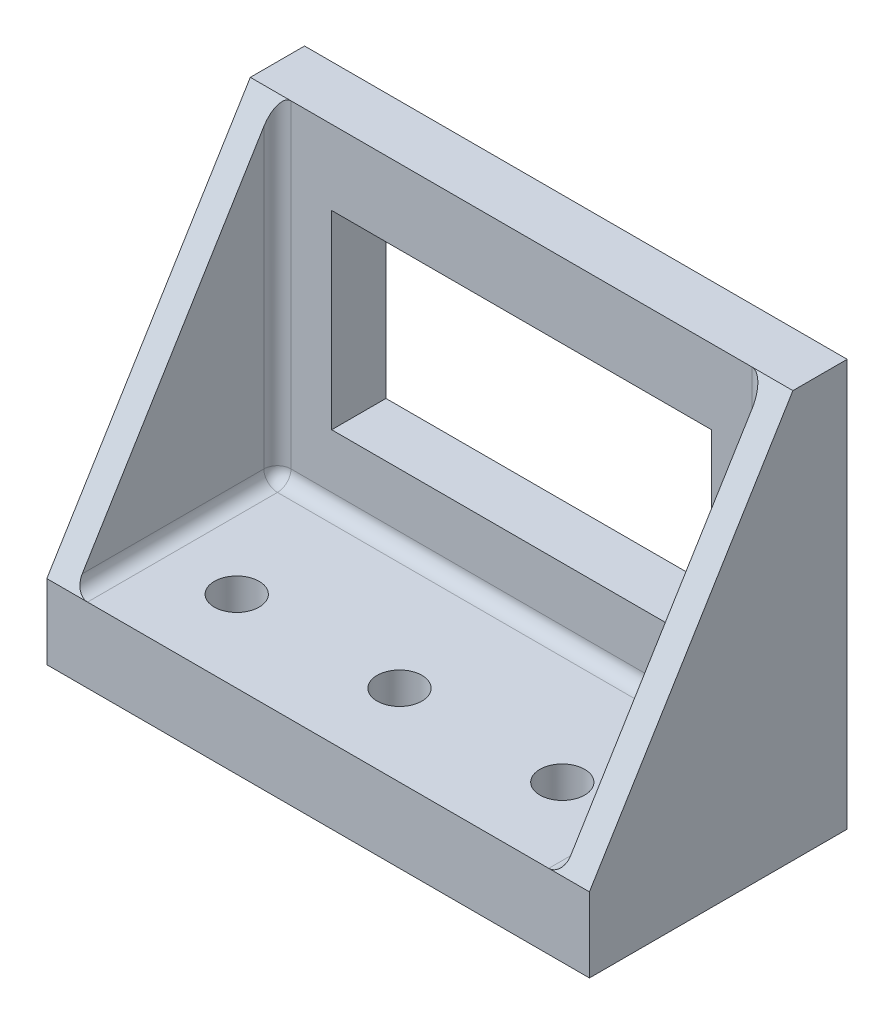
from build123d import *

# Parameters (mm, degrees)
SKETCH1_W           = 40
SKETCH1_H           = 30
BOSS_EXTRUDE1_DEPTH = 4
SKETCH4_W           = 28
SKETCH4_H           = 14
CUT_EXTRUDE1_DEPTH  = 5.5
SKETCH5_W           = 40
SKETCH5_H           = 5.5
BOSS_EXTRUDE2_DEPTH = 15
SKETCH6_R           = 1.65
CUT_EXTRUDE3_DEPTH  = 15
RIB1_REACH          = 50.297
SKETCH8_WALL_W      = 127.321837908
SKETCH8_WALL_H      = 2
RIB14_REACH         = 50.297
SKETCH11_WALL_W     = 127.321837908
SKETCH11_WALL_H     = 2
FILLET1_R           = 1


with BuildPart() as part:
    # Sketch1 → Boss-Extrude1 (new body)
    with BuildSketch(Plane.XY):
        with Locations((-0.222222222, -4.277777778)):
            Rectangle(SKETCH1_W, SKETCH1_H)
    extrude(amount=BOSS_EXTRUDE1_DEPTH)

    # Sketch4 → Cut-Extrude1 (cut)
    with BuildSketch(Plane.XY.offset(4)):
        with Locations((-0.222222222, -1.777777778)):
            Rectangle(SKETCH4_W, SKETCH4_H)
    extrude(amount=-CUT_EXTRUDE1_DEPTH, mode=Mode.SUBTRACT)

    # Sketch5 → Boss-Extrude2 (add)
    with BuildSketch(Plane.XY.offset(4)):
        with Locations((-0.222222222, -16.527777778)):
            Rectangle(SKETCH5_W, SKETCH5_H)
    extrude(amount=BOSS_EXTRUDE2_DEPTH)

    # Sketch6 → Cut-Extrude3 (cut)
    with BuildSketch(Plane.XZ.offset(19.277777778)):
        with Locations((-12.222222222, 13)):
            Circle(SKETCH6_R)
        with Locations((-0.222222222, 13)):
            Circle(SKETCH6_R)
        with Locations((11.777777778, 13)):
            Circle(SKETCH6_R)
    extrude(amount=-CUT_EXTRUDE3_DEPTH, mode=Mode.SUBTRACT)

    # Sketch8 wall → Rib1 (add, up to next)
    with BuildSketch(Plane(origin=(-20.222222222, -1.527777778, 11.5), x_dir=(0, -0.852851304076, 0.522153859639), z_dir=(0, 0.522153859639, 0.852851304076)), mode=Mode.PRIVATE) as rib1_sk1:
        with Locations((0, 1)):
            Rectangle(SKETCH8_WALL_W, SKETCH8_WALL_H)
    rib1_tool1 = extrude(rib1_sk1.sketch, amount=-RIB1_REACH, mode=Mode.PRIVATE) - part.part
    add(rib1_tool1.solids().sort_by_distance((-20.222222222, -1.527777778, 11.5))[0])

    # Sketch11 wall → Rib14 (add, up to next)
    with BuildSketch(Plane(origin=(19.777777778, -1.527777778, 11.5), x_dir=(0, 0.852851304076, -0.522153859639), z_dir=(0, 0.522153859639, 0.852851304076)), mode=Mode.PRIVATE) as rib14_sk1:
        with Locations((0, 1)):
            Rectangle(SKETCH11_WALL_W, SKETCH11_WALL_H)
    rib14_tool1 = extrude(rib14_sk1.sketch, amount=-RIB14_REACH, mode=Mode.PRIVATE) - part.part
    add(rib14_tool1.solids().sort_by_distance((19.777777778, -1.527777778, 11.5))[0])

    # Fillet1
    fillet1_edges = [part.edges().sort_by_distance(p)[0] for p in [
        (17.777777778, -13.777777778, 11.5),
        (-18.222222222, -13.777777778, 11.5),
        (-0.222222222, -13.777777778, 4),
        (17.777777778, -1.527777778, 4),
        (-18.222222222, -1.527777778, 4),
    ]]
    fillet(fillet1_edges, radius=FILLET1_R)


solid = part.part
